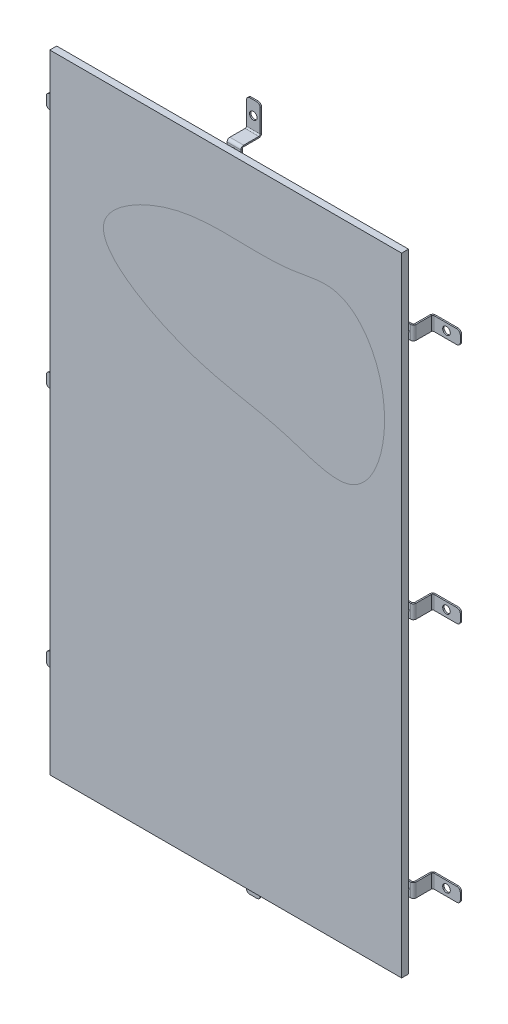
from build123d import *

# Parameters (mm, degrees)
SKETCH1_W               = 255
SKETCH1_H               = 455
BOSS_EXTRUDE1_DEPTH     = 5
SKETCH2_R               = 2.75
BASE_FLANGE1_DEPTH      = 1
JOG1_START              = 145
JOG1_DEPTH              = 10
JOG1_START_2            = 147.5
JOG1_2_DEPTH            = 5
JOG1_START_3            = -8
JOG1_3_DEPTH            = 1.974012
JOG1_START_4            = -20
JOG1_4_OUTLINE_W        = 2.5
JOG1_4_OUTLINE_H        = 1
JOG1_4_DEPTH            = 12.152182
JOG1_START_5            = -7
JOG1_5_DEPTH            = 1
JOG1_6_DEPTH            = 10
JOG1_7_DEPTH            = 10
SKETCH9_R               = 3.5
BOSS_EXTRUDE2_DEPTH     = 1
BODY_MOVE_COPY4_ANGLE   = 90
BODY_MOVE_COPY4_2_ANGLE = 90
LPATTERN1_COUNT         = 2
LPATTERN1_PITCH         = 175


with BuildPart() as part:
    # Sketch1 → Boss-Extrude1 (new body)
    with BuildSketch(Plane.XY):
        with Locations((150, 250)):
            Rectangle(SKETCH1_W, SKETCH1_H)
    extrude(amount=-BOSS_EXTRUDE1_DEPTH)


with BuildPart() as body_2:
    # Base-Flange1: sheet metal written as solids
    # Sketch2 → Base-Flange1 (new body)
    with BuildSketch(Plane(origin=(0, 0, -20), x_dir=(-1, 0, 0), z_dir=(0, 0, -1))):
        with BuildLine():
            Line((-147.5, 0), (-152.5, 0))
            ThreePointArc((-152.5, 0), (-154.267767, 0.732233), (-155, 2.5))
            Line((-155, 2.5), (-155, 31.5))
            ThreePointArc((-155, 31.5), (-154.267767, 33.267767), (-152.5, 34))
            Line((-152.5, 34), (-147.5, 34))
            ThreePointArc((-147.5, 34), (-145.732233, 33.267767), (-145, 31.5))
            Line((-145, 31.5), (-145, 2.5))
            ThreePointArc((-145, 2.5), (-145.732233, 0.732233), (-147.5, 0))
        make_face()
        with Locations(Location((-150, 10, 0), (0, 0, 90))):
            Circle(SKETCH2_R, mode=Mode.SUBTRACT)
    extrude(amount=BASE_FLANGE1_DEPTH)

    # Jog1: read off the stored shape, not the designer's step
    # Jog1 outline → Jog1 (cut)
    with BuildSketch(Plane.YZ.offset(JOG1_START)):
        with BuildLine():
            Line((34, -20), (20.732051, -20))
            ThreePointArc((20.732051, -20), (20, -20.732051), (19, -21))
            Line((19, -21), (34, -21))
            Line((34, -21), (34, -20))
        make_face()
    extrude(amount=JOG1_DEPTH, mode=Mode.SUBTRACT)

    # Jog1 2 outline → Jog1 2 (add)
    with BuildSketch(Plane.YZ.offset(JOG1_START_2)):
        with BuildLine():
            Line((21, -19), (21, -8))
            ThreePointArc((21, -8), (21.292893, -7.292893), (22, -7))
            Line((22, -7), (34, -7))
            Line((34, -7), (34, -6))
            Line((34, -6), (22, -6))
            ThreePointArc((22, -6), (20.585786, -6.585786), (20, -8))
            Line((20, -8), (20, -19))
            ThreePointArc((20, -19), (19.707107, -19.707107), (19, -20))
            Line((19, -20), (20.732051, -20))
            ThreePointArc((20.732051, -20), (20.931852, -19.517638), (21, -19))
        make_face()
    extrude(amount=JOG1_2_DEPTH)

    # Jog1 3 outline → Jog1 3 (add)
    with BuildSketch(Plane.XY.offset(JOG1_START_3)):
        with BuildLine():
            Line((145, 20), (147.5, 20))
            Line((147.5, 20), (147.5, 34))
            ThreePointArc((147.5, 34), (145.732233, 33.267767), (145, 31.5))
            Line((145, 31.5), (145, 20))
        make_face()
        with BuildLine():
            Line((152.5, 20), (155, 20))
            Line((155, 20), (155, 31.5))
            ThreePointArc((155, 31.5), (154.267767, 33.267767), (152.5, 34))
            Line((152.5, 34), (152.5, 20))
        make_face()
    extrude(amount=JOG1_3_DEPTH)

    # Jog1 4 outline → Jog1 4 (add)
    with BuildSketch(Plane.XY.offset(JOG1_START_4)):
        with Locations((146.25, 20.5)):
            Rectangle(JOG1_4_OUTLINE_W, JOG1_4_OUTLINE_H)
        with Locations((153.75, 20.5)):
            Rectangle(JOG1_4_OUTLINE_W, JOG1_4_OUTLINE_H)
    extrude(amount=JOG1_4_DEPTH)

    # Jog1 5 outline → Jog1 5 (add)
    with BuildSketch(Plane.XY.offset(JOG1_START_5)):
        with BuildLine():
            Line((145, 31.5), (145, 21))
            Line((145, 21), (147.5, 21))
            Line((147.5, 21), (147.5, 34))
            ThreePointArc((147.5, 34), (145.732233, 33.267767), (145, 31.5))
        make_face()
        with BuildLine():
            Line((152.5, 34), (152.5, 21))
            Line((152.5, 21), (155, 21))
            Line((155, 21), (155, 31.5))
            ThreePointArc((155, 31.5), (154.267767, 33.267767), (152.5, 34))
        make_face()
    extrude(amount=JOG1_5_DEPTH)

    # Jog1 6 outline → Jog1 6 (cut)
    with BuildSketch(Plane.YZ.offset(JOG1_START)):
        with BuildLine():
            ThreePointArc((21, -19), (20.931852, -19.517638), (20.732051, -20))
            ThreePointArc((20.732051, -20), (20.414214, -20.414214), (20, -20.732051))
            Line((20, -20.732051), (20, -21))
            Line((20, -21), (36, -21))
            Line((36, -21), (36, -7))
            Line((36, -7), (22, -7))
            ThreePointArc((22, -7), (21.292893, -7.292893), (21, -8))
            Line((21, -8), (21, -19))
        make_face()
        with BuildLine():
            Line((21, -6), (21, -6.025988))
            Line((21, -6.025988), (20, -6.025988))
            Line((20, -6.025988), (20, -8))
            ThreePointArc((20, -8), (20.585786, -6.585786), (22, -6))
            Line((22, -6), (36, -6))
            Line((36, -6), (36, -5))
            Line((36, -5), (21, -5))
            Line((21, -5), (21, -6))
        make_face()
    extrude(amount=JOG1_6_DEPTH, mode=Mode.SUBTRACT)

    # Jog1 7 outline → Jog1 7 (add)
    with BuildSketch(Plane.YZ.offset(JOG1_START)):
        with BuildLine():
            ThreePointArc((19, -21), (19.517638, -20.931852), (20, -20.732051))
            Line((20, -20.732051), (20, -20))
            Line((20, -20), (20, -19))
            ThreePointArc((20, -19), (19.707107, -19.707107), (19, -20))
            Line((19, -20), (18, -20))
            Line((18, -20), (18, -21))
            Line((18, -21), (19, -21))
        make_face()
    extrude(amount=JOG1_7_DEPTH)


with BuildPart() as body_3:
    # Sketch9 → Boss-Extrude2 (new body)
    with BuildSketch(Plane.XY.offset(-6)):
        with Locations((150, 26.75)):
            Circle(SKETCH9_R)
    extrude(amount=BOSS_EXTRUDE2_DEPTH)


with BuildPart() as body_4:
    # Mirror1: mirrored copy
    add(body_2.part.mirror(Plane(origin=(0, 250, 0), x_dir=(0, 0, 1), z_dir=(0, -1, 0))))


with BuildPart() as body_5:
    # Mirror1 2: mirrored copy
    add(body_3.part.mirror(Plane(origin=(0, 250, 0), x_dir=(0, 0, 1), z_dir=(0, -1, 0))))


with BuildPart() as body_6:
    # Body-Move/Copy3: read off the stored shape, not the designer's step
    # Body-Move/Copy3: copy of body 5
    add(body_5.part.moved(Location((0, -446.5, 0))))


with BuildPart() as body_7:
    # Body-Move_Copy3 2: mirrored copy
    add(body_4.part.mirror(Plane(origin=(0, 250, 0), x_dir=(1, 0, 0), z_dir=(0, 1, 0))))


with BuildPart() as body_3_1:
    # Body-Move/Copy4: read off the stored shape, not the designer's step
    # Body-Move/Copy4: moved
    add(body_3.part.moved(Location((-225, 0, 0))).rotate(Axis((0, 0, 0), (0, 0, -1)), BODY_MOVE_COPY4_ANGLE))


with BuildPart() as body_2_1:
    # Body-Move_Copy4 2: moved
    add(body_2.part.moved(Location((-225, 0, 0))).rotate(Axis((0, 0, 0), (0, 0, -1)), BODY_MOVE_COPY4_2_ANGLE))


with BuildPart() as body_8:
    # Mirror2: mirrored copy
    add(body_2_1.part.mirror(Plane(origin=(0, 250, 0), x_dir=(0, 0, 1), z_dir=(0, -1, 0))))


with BuildPart() as body_9:
    # Mirror2 2: mirrored copy
    add(body_3_1.part.mirror(Plane(origin=(0, 250, 0), x_dir=(0, 0, 1), z_dir=(0, -1, 0))))


with BuildPart() as lpattern1_1:
    # LPattern1: pattern copy
    add(body_3_1.part.moved(Location(Vector(0, 1, 0) * (1 * LPATTERN1_PITCH))))


with BuildPart() as lpattern1_2:
    # LPattern1: pattern copy
    add(body_2_1.part.moved(Location(Vector(0, 1, 0) * (1 * LPATTERN1_PITCH))))


with BuildPart() as body_12:
    # Mirror3: mirrored copy
    add(body_8.part.mirror(Plane(origin=(150, 0, 0), x_dir=(0, 0, 1), z_dir=(1, 0, 0))))


with BuildPart() as body_13:
    # Mirror3 2: mirrored copy
    add(lpattern1_2.part.mirror(Plane(origin=(150, 0, 0), x_dir=(0, 0, 1), z_dir=(1, 0, 0))))


with BuildPart() as body_14:
    # Mirror3 3: mirrored copy
    add(body_2_1.part.mirror(Plane(origin=(150, 0, 0), x_dir=(0, 0, 1), z_dir=(1, 0, 0))))


with BuildPart() as body_15:
    # Mirror3 4: mirrored copy
    add(body_3_1.part.mirror(Plane(origin=(150, 0, 0), x_dir=(0, 0, 1), z_dir=(1, 0, 0))))


with BuildPart() as body_16:
    # Mirror3 5: mirrored copy
    add(lpattern1_1.part.mirror(Plane(origin=(150, 0, 0), x_dir=(0, 0, 1), z_dir=(1, 0, 0))))


with BuildPart() as body_17:
    # Mirror3 6: mirrored copy
    add(body_9.part.mirror(Plane(origin=(150, 0, 0), x_dir=(0, 0, 1), z_dir=(1, 0, 0))))


solid = Compound([part.part, body_4.part, body_5.part, body_6.part, body_7.part, body_3_1.part, body_2_1.part, body_8.part, body_9.part, lpattern1_1.part, lpattern1_2.part, body_12.part, body_13.part, body_14.part, body_15.part, body_16.part, body_17.part])
